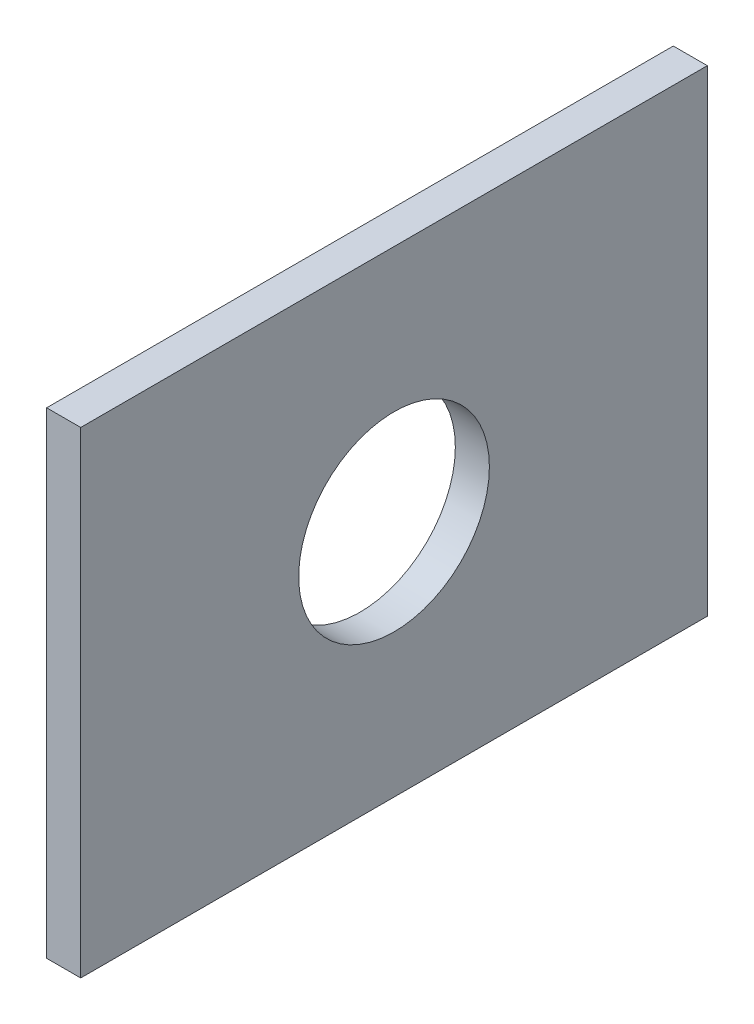
from build123d import *

# Parameters (mm, degrees)
SKETCH1_W           = 92
SKETCH1_H           = 70
SKETCH1_R           = 14
BOSS_EXTRUDE1_DEPTH = 5


with BuildPart() as part:
    # Sketch1 → Boss-Extrude1 (new body)
    with BuildSketch(Plane(origin=(0, 0, 0), x_dir=(0, 0, -1), z_dir=(1, 0, 0))):
        with Locations((46, -35)):
            Rectangle(SKETCH1_W, SKETCH1_H)
        with Locations((46, -35)):
            Circle(SKETCH1_R, mode=Mode.SUBTRACT)
    extrude(amount=BOSS_EXTRUDE1_DEPTH)


solid = part.part
